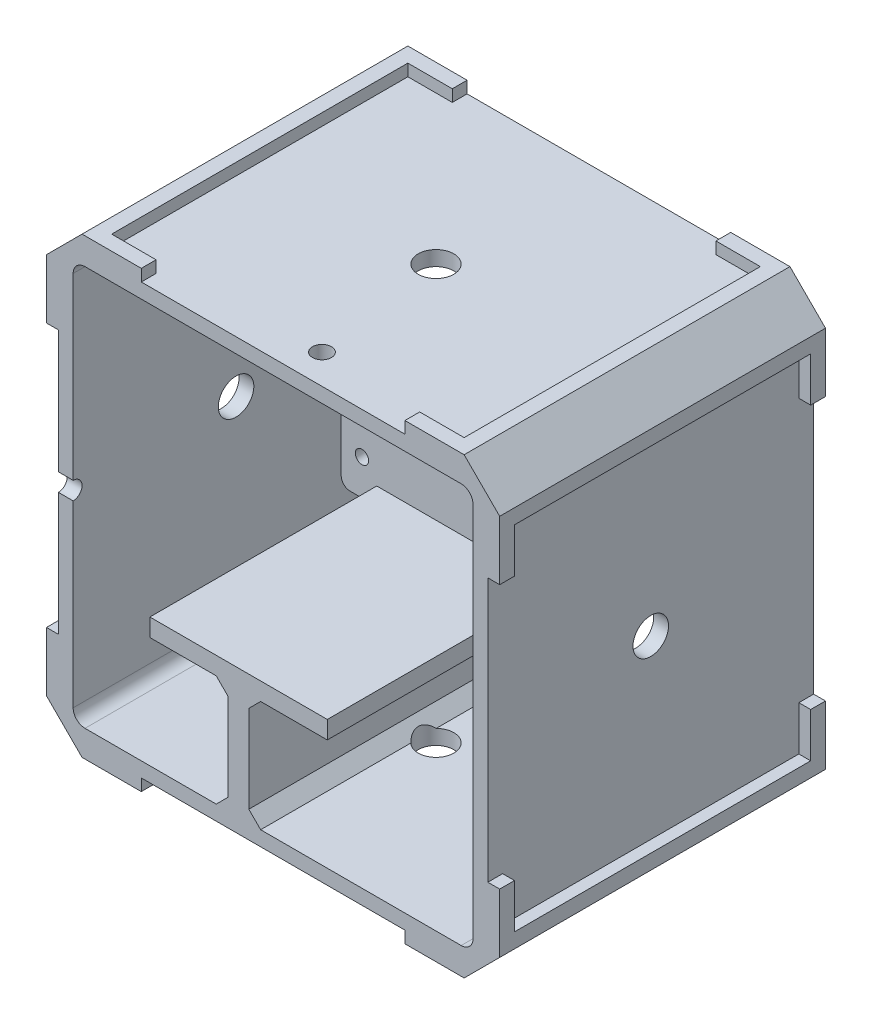
from build123d import *

# Parameters (mm, degrees)
BOSS_EXTRUDE1_DEPTH             = 55
SKETCH2_W                       = 67.5
SKETCH2_H                       = 67.5
BOSS_EXTRUDE2_DEPTH             = 2.5
CUT_EXTRUDE2_REACH              = 77.187
SKETCH4_R                       = 1.65
MIRROR2_COPY_1_REACH            = 77.187
MIRROR2_COPY_1_SKETCH_R         = 1.65
BOSS_EXTRUDE3_DEPTH             = 14.6
BOSS_EXTRUDE3_DEPTH_BACK        = 25.8
BOSS_EXTRUDE4_DEPTH             = 49.7
SKETCH7_W                       = 37.9
SKETCH7_H                       = 22.75
CUT_EXTRUDE3_DEPTH              = 8.4
BOSS_EXTRUDE7_DEPTH             = 2
CUT_EXTRUDE6_REACH              = 84.442
CUT_EXTRUDE6_DIRECTION_2_DEPTH  = 83.442009922
CUT_EXTRUDE8_DEPTH              = 103.907106169
CUT_EXTRUDE8_DEPTH_BACK         = 2.5
SKETCH15_R                      = 1.6
SKETCH16_W                      = 7.5
SKETCH16_H                      = 1.65
BOSS_EXTRUDE8_DEPTH             = 7
CUT_EXTRUDE9_REACH              = 74.438
SKETCH17_R                      = 1.125
SKETCH19_R                      = 3
CUT_EXTRUDE10_DEPTH             = 2.5
BOSS_EXTRUDE9_DEPTH             = 2
CIRPATTERN1_COUNT               = 4
CIRPATTERN2_COUNT               = 4
BOSS_EXTRUDE12_DEPTH            = 55
CUT_EXTRUDE12_REACH             = 75.459
SKETCH23_W                      = 6.5
SKETCH23_H                      = 16
CHAMFER1_SIZE                   = 0.75
CUT_EXTRUDE13_REACH             = 91.486
SKETCH25_W                      = 3
SKETCH25_H                      = 35
SKETCH25_W_2                    = 5
SKETCH25_H_2                    = 46.7
FILLET3_R                       = 1.5
SKETCH26_W                      = 12.543976605
SKETCH26_H                      = 9.586128164
CUT_EXTRUDE14_DEPTH             = 90.261665904
SKETCH27_W                      = 6.75
SKETCH27_H                      = 1.4
BOSS_EXTRUDE14_DEPTH            = 1.25
CHAMFER2_SIZE                   = 2
CUT_EXTRUDE15_REACH             = 85.744
SKETCH28_W                      = 7.624106446
SKETCH28_H                      = 46.373052842
SKETCH29_W                      = 40.4
SKETCH29_H                      = 3
BOSS_EXTRUDE15_DEPTH            = 18.75
BOSS_EXTRUDE16_DEPTH            = 4
CHAMFER3_SIZE                   = 0.75
CHAMFER3_OF_MIRROR3_SIZE        = 0.75
MIRROR4_START                   = 2.5
MIRROR4_DEPTH                   = 4
CUT_EXTRUDE16_REACH             = 102.191
SKETCH32_R                      = 1.5
CUT_EXTRUDE16_DIRECTION_2_DEPTH = 101.19137937
BOSS_EXTRUDE17_DEPTH            = 5
CUT_EXTRUDE17_REACH             = 68.28
SKETCH37_W                      = 5
SKETCH37_H                      = 18.75
SKETCH37_W_2                    = 5.675
BOSS_EXTRUDE18_DEPTH            = 5
BOSS_EXTRUDE19_DEPTH            = 3
FILLET4_R                       = 1.5
FILLET5_R                       = 1.5


with BuildPart() as part:
    # Sketch1 → Boss-Extrude1 (new body)
    with BuildSketch(Plane.XY):
        with BuildLine():
            Line((-36.25, 32.25), (-36.25, -32.25))
            ThreePointArc((-36.25, -32.25), (-35.078427125, -35.078427125), (-32.25, -36.25))
            Line((-32.25, -36.25), (32.25, -36.25))
            ThreePointArc((32.25, -36.25), (35.078427125, -35.078427125), (36.25, -32.25))
            Line((36.25, -32.25), (36.25, 32.25))
            ThreePointArc((36.25, 32.25), (35.078427125, 35.078427125), (32.25, 36.25))
            Line((32.25, 36.25), (-32.25, 36.25))
            ThreePointArc((-32.25, 36.25), (-35.078427125, 35.078427125), (-36.25, 32.25))
        make_face()
        with BuildLine():
            Line((-31.75, 33.75), (31.75, 33.75))
            ThreePointArc((31.75, 33.75), (33.164213562, 33.164213562), (33.75, 31.75))
            Line((33.75, 31.75), (33.75, -31.75))
            ThreePointArc((33.75, -31.75), (33.164213562, -33.164213562), (31.75, -33.75))
            Line((31.75, -33.75), (-31.75, -33.75))
            ThreePointArc((-31.75, -33.75), (-33.164213562, -33.164213562), (-33.75, -31.75))
            Line((-33.75, -31.75), (-33.75, 31.75))
            ThreePointArc((-33.75, 31.75), (-33.164213562, 33.164213562), (-31.75, 33.75))
        make_face(mode=Mode.SUBTRACT)
    extrude(amount=BOSS_EXTRUDE1_DEPTH)

    # Sketch2 → Boss-Extrude2 (add)
    with BuildSketch(Plane.XY):
        Rectangle(SKETCH2_W, SKETCH2_H)
    extrude(amount=BOSS_EXTRUDE2_DEPTH)

    # Sketch4 → Cut-Extrude2 (cut, up to next)
    with BuildSketch(Plane(origin=(0, 0, 0), x_dir=(-1, 0, 0), z_dir=(0, 0, -1)), mode=Mode.PRIVATE) as cut_extrude2_sk1:
        with Locations((-28.75, 28.75)):
            Circle(SKETCH4_R)
    cut_extrude2_tool1 = extrude(cut_extrude2_sk1.sketch, amount=-CUT_EXTRUDE2_REACH, mode=Mode.PRIVATE) & part.part
    cut_extrude2 = cut_extrude2_tool1.solids().sort_by_distance((28.75, 28.75, 0))[0]
    add(cut_extrude2, mode=Mode.SUBTRACT)

    # Mirror1: Cut-Extrude2 across plane
    add(cut_extrude2.mirror(Plane(origin=(0, 0, 0), x_dir=(0, 0, 1), z_dir=(1, 0, 0))), mode=Mode.SUBTRACT)

    # Mirror2: Cut-Extrude2 across plane
    add(cut_extrude2.mirror(Plane.ZX), mode=Mode.SUBTRACT)

    # Mirror2 copy 1 sketch → Mirror2 copy 1 (cut, up to next)
    with BuildSketch(Plane(origin=(0, 0, 0), x_dir=(1, 0, 0), z_dir=(0, 0, -1)), mode=Mode.PRIVATE) as mirror2_copy_1_sk1:
        with Locations((-28.75, 28.75)):
            Circle(MIRROR2_COPY_1_SKETCH_R)
    mirror2_copy_1_tool1 = extrude(mirror2_copy_1_sk1.sketch, amount=-MIRROR2_COPY_1_REACH, mode=Mode.PRIVATE) & part.part
    add(mirror2_copy_1_tool1.solids().sort_by_distance((-28.75, -28.75, 0))[0], mode=Mode.SUBTRACT)



with BuildPart() as body_2:
    # Sketch5 → Boss-Extrude3 (new, two sides: drawn at the far end of the back side and taken through both)
    with BuildSketch(Plane(origin=(0, 0, 0), x_dir=(0, 0, -1), z_dir=(1, 0, 0)).offset(-BOSS_EXTRUDE3_DEPTH_BACK)):
        Polygon((-16.7, 12), (-16.7, -12), (-60.4, -12), (-63.4, -12), (-63.4, -15), (-13.7, -15), (-13.7, 12), align=None)
    extrude(amount=BOSS_EXTRUDE3_DEPTH + BOSS_EXTRUDE3_DEPTH_BACK)


with BuildPart() as part_1:
    add(part.part)

    add(body_2.part)  # Boss-Extrude4 merges body 2
    # Sketch6 → Boss-Extrude4 (add)
    with BuildSketch(Plane.XY.offset(63.4)):
        Polygon((-25.8, -12), (12.1, -12), (12.1, -15), (-4.1, -15), (-4.1, -33.75), (12.1, -33.75), (12.1, -36.25), (-25.8, -36.25), (-25.8, -33.75), (-7.6, -33.75), (-7.6, -15), (-25.8, -15), align=None)
    extrude(amount=-BOSS_EXTRUDE4_DEPTH)

    # Sketch7 → Cut-Extrude3 (cut)
    with BuildSketch(Plane.XY.offset(63.4)):
        with Locations((-6.85, -24.875)):
            Rectangle(SKETCH7_W, SKETCH7_H)
    extrude(amount=-CUT_EXTRUDE3_DEPTH, mode=Mode.SUBTRACT)

    # Sketch12 → Boss-Extrude7 (add)
    with BuildSketch(Plane(origin=(0, 36.25, 0), x_dir=(1, 0, 0), z_dir=(0, 1, 0))):
        Polygon((29.75, -55), (32.25, -55), (32.25, -52.5), (32.25, -45), (29.75, -45), (29.75, -52.5), (22.25, -52.5), (22.25, -55), align=None)
        Polygon((-32.25, 0), (-32.25, -10), (-29.75, -10), (-29.75, -2.5), (-22.25, -2.5), (-22.25, 0), align=None)
    boss_extrude7 = extrude(amount=BOSS_EXTRUDE7_DEPTH)

    # Sketch13 → Cut-Extrude6 (cut, up to next)
    with BuildSketch(Plane(origin=(0, 0, 0), x_dir=(-1, 0, 0), z_dir=(0, 0, -1)), mode=Mode.PRIVATE) as cut_extrude6_sk1:
        with BuildLine():
            Line((-33.75, 21.25), (-25.25, 21.25))
            ThreePointArc((-25.25, 21.25), (-22.421572875, 22.421572875), (-21.25, 25.25))
            Line((-21.25, 25.25), (-21.25, 33.75))
            Line((-21.25, 33.75), (21.25, 33.75))
            Line((21.25, 33.75), (21.25, 25.25))
            ThreePointArc((21.25, 25.25), (22.421572875, 22.421572875), (25.25, 21.25))
            Line((25.25, 21.25), (33.75, 21.25))
            Line((33.75, 21.25), (33.75, -21.25))
            Line((33.75, -21.25), (25.25, -21.25))
            ThreePointArc((25.25, -21.25), (22.421572875, -22.421572875), (21.25, -25.25))
            Line((21.25, -25.25), (21.25, -33.75))
            Line((21.25, -33.75), (-21.25, -33.75))
            Line((-21.25, -33.75), (-21.25, -25.25))
            ThreePointArc((-21.25, -25.25), (-22.421572875, -22.421572875), (-25.25, -21.25))
            Line((-25.25, -21.25), (-33.75, -21.25))
            Line((-33.75, -21.25), (-33.75, 21.25))
        make_face()
    cut_extrude6_tool1 = extrude(cut_extrude6_sk1.sketch, amount=-CUT_EXTRUDE6_REACH, mode=Mode.PRIVATE) & part_1.part
    add(cut_extrude6_tool1.solids().sort_by_distance((0, 0, 0))[0], mode=Mode.SUBTRACT)

    # Sketch13 → Cut-Extrude6 direction 2 (cut)
    with BuildSketch(Plane(origin=(0, 0, 0), x_dir=(-1, 0, 0), z_dir=(0, 0, -1))):
        with BuildLine():
            Line((-33.75, 21.25), (-25.25, 21.25))
            ThreePointArc((-25.25, 21.25), (-22.421572875, 22.421572875), (-21.25, 25.25))
            Line((-21.25, 25.25), (-21.25, 33.75))
            Line((-21.25, 33.75), (21.25, 33.75))
            Line((21.25, 33.75), (21.25, 25.25))
            ThreePointArc((21.25, 25.25), (22.421572875, 22.421572875), (25.25, 21.25))
            Line((25.25, 21.25), (33.75, 21.25))
            Line((33.75, 21.25), (33.75, -21.25))
            Line((33.75, -21.25), (25.25, -21.25))
            ThreePointArc((25.25, -21.25), (22.421572875, -22.421572875), (21.25, -25.25))
            Line((21.25, -25.25), (21.25, -33.75))
            Line((21.25, -33.75), (-21.25, -33.75))
            Line((-21.25, -33.75), (-21.25, -25.25))
            ThreePointArc((-21.25, -25.25), (-22.421572875, -22.421572875), (-25.25, -21.25))
            Line((-25.25, -21.25), (-33.75, -21.25))
            Line((-33.75, -21.25), (-33.75, 21.25))
        make_face()
    extrude(amount=CUT_EXTRUDE6_DIRECTION_2_DEPTH, mode=Mode.SUBTRACT)

    # Sketch15 → Cut-Extrude8 (cut, two sides: drawn at the far end of the back side and taken through both)
    with BuildSketch(Plane(origin=(0, 36.25, 0), x_dir=(1, 0, 0), z_dir=(0, 1, 0)).offset(-CUT_EXTRUDE8_DEPTH_BACK)):
        with Locations(Location((3.25, -50, 0), (0, 0, 270))):
            Circle(SKETCH15_R)
    extrude(amount=CUT_EXTRUDE8_DEPTH + CUT_EXTRUDE8_DEPTH_BACK, mode=Mode.SUBTRACT)

    # Sketch16 → Boss-Extrude8 (add)
    with BuildSketch(Plane(origin=(-33.75, 0, 0), x_dir=(0, 0, -1), z_dir=(1, 0, 0))):
        with Locations((-16.5, 29.525)):
            Rectangle(SKETCH16_W, SKETCH16_H)
    extrude(amount=BOSS_EXTRUDE8_DEPTH)

    # Sketch17 → Cut-Extrude9 (cut, up to next)
    with BuildSketch(Plane(origin=(0, 0, 13.7), x_dir=(-1, 0, 0), z_dir=(0, 0, -1)), mode=Mode.PRIVATE) as cut_extrude9_sk1:
        with Locations(Location((-12.1, 9, 0), (0, 0, 90))):
            Circle(SKETCH17_R)
    cut_extrude9_tool1 = extrude(cut_extrude9_sk1.sketch, amount=-CUT_EXTRUDE9_REACH, mode=Mode.PRIVATE) & part_1.part
    # Sketch17 → Cut-Extrude9 (cut, up to next)
    with BuildSketch(Plane(origin=(0, 0, 13.7), x_dir=(-1, 0, 0), z_dir=(0, 0, -1)), mode=Mode.PRIVATE) as cut_extrude9_sk2:
        with Locations(Location((-12.1, -9, 0), (0, 0, 90))):
            Circle(SKETCH17_R)
    cut_extrude9_tool2 = extrude(cut_extrude9_sk2.sketch, amount=-CUT_EXTRUDE9_REACH, mode=Mode.PRIVATE) & part_1.part
    # Sketch17 → Cut-Extrude9 (cut, up to next)
    with BuildSketch(Plane(origin=(0, 0, 13.7), x_dir=(-1, 0, 0), z_dir=(0, 0, -1)), mode=Mode.PRIVATE) as cut_extrude9_sk3:
        with Locations(Location((23.3, -9, 0), (0, 0, 90))):
            Circle(SKETCH17_R)
    cut_extrude9_tool3 = extrude(cut_extrude9_sk3.sketch, amount=-CUT_EXTRUDE9_REACH, mode=Mode.PRIVATE) & part_1.part
    add(cut_extrude9_tool1.solids().sort_by_distance((12.1, 9, 13.7))[0], mode=Mode.SUBTRACT)
    add(cut_extrude9_tool2.solids().sort_by_distance((12.1, -9, 13.7))[0], mode=Mode.SUBTRACT)
    add(cut_extrude9_tool3.solids().sort_by_distance((-23.3, -9, 13.7))[0], mode=Mode.SUBTRACT)

    # Sketch19 → Cut-Extrude10 (cut)
    with BuildSketch(Plane(origin=(0, 36.25, 0), x_dir=(1, 0, 0), z_dir=(0, 1, 0))):
        with Locations(Location((0, -27.5, 0), (0, 0, 270))):
            Circle(SKETCH19_R)
    cut_extrude10 = extrude(amount=-CUT_EXTRUDE10_DEPTH, mode=Mode.SUBTRACT)

    # Sketch20 → Boss-Extrude9 (add)
    with BuildSketch(Plane(origin=(36.25, 0, -36.25), x_dir=(0, 0, 1), z_dir=(-1, 0, 0))):
        Polygon((91.25, 32.25), (81.25, 32.25), (81.25, 29.75), (88.75, 29.75), (88.75, 22.25), (91.25, 22.25), align=None)
        Polygon((36.25, -22.25), (36.25, -32.25), (46.25, -32.25), (46.25, -29.75), (38.75, -29.75), (38.75, -22.25), align=None)
    boss_extrude9 = extrude(amount=-BOSS_EXTRUDE9_DEPTH)

    # CirPattern1: Boss-Extrude7, Cut-Extrude10 ×4 about axis
    cirpattern1_axis = Axis((0, 0, 0), (0, 0, 1))
    add([boss_extrude7.rotate(cirpattern1_axis, i * 360 / CIRPATTERN1_COUNT) for i in range(1, CIRPATTERN1_COUNT)])
    add([cut_extrude10.rotate(cirpattern1_axis, i * 360 / CIRPATTERN1_COUNT) for i in range(1, CIRPATTERN1_COUNT)], mode=Mode.SUBTRACT)

    # CirPattern2: Boss-Extrude9 ×4 about axis
    cirpattern2_axis = Axis((0, 0, 0), (0, 0, 1))
    for i in range(1, CIRPATTERN2_COUNT):
        add(boss_extrude9.rotate(cirpattern2_axis, i * 360 / CIRPATTERN2_COUNT))

    # Sketch22 → Boss-Extrude12 (add, through all)
    with BuildSketch(Plane.XY.offset(55)):
        Polygon((-38.25, 32.25), (-32.25, 38.25), (-29.75, 38.25), (-29.75, 33.75), (-33.75, 33.75), (-33.75, 29.75), (-38.25, 29.75), align=None)
        Polygon((33.75, 33.75), (33.75, 29.75), (38.25, 29.75), (38.25, 32.25), (32.25, 38.25), (29.75, 38.25), (29.75, 33.75), align=None)
        Polygon((38.25, -32.25), (32.25, -38.25), (29.75, -38.25), (29.75, -33.75), (33.75, -33.75), (33.75, -29.75), (38.25, -29.75), align=None)
        Polygon((-33.75, -33.75), (-33.75, -29.75), (-38.25, -29.75), (-38.25, -32.25), (-32.25, -38.25), (-29.75, -38.25), (-29.75, -33.75), align=None)
    extrude(amount=-BOSS_EXTRUDE12_DEPTH)

    # Sketch23 → Cut-Extrude12 (cut, up to next)
    with BuildSketch(Plane(origin=(0, 0, 13.7), x_dir=(-1, 0, 0), z_dir=(0, 0, -1)), mode=Mode.PRIVATE) as cut_extrude12_sk1:
        with Locations((22.55, 4)):
            Rectangle(SKETCH23_W, SKETCH23_H)
    cut_extrude12_tool1 = extrude(cut_extrude12_sk1.sketch, amount=-CUT_EXTRUDE12_REACH, mode=Mode.PRIVATE) & part_1.part
    add(cut_extrude12_tool1.solids().sort_by_distance((-22.55, 4, 13.7))[0], mode=Mode.SUBTRACT)

    # Chamfer1
    chamfer1_edges = [part_1.edges().sort_by_distance(p)[0] for p in [
        (-33.75, 28.7, 16.5),
        (-30.25, 30.35, 20.25),
        (-26.75, 30.35, 16.5),
    ]]
    chamfer(chamfer1_edges, length=CHAMFER1_SIZE)

    # Sketch25 → Cut-Extrude13 (cut, up to next)
    with BuildSketch(Plane(origin=(0, -12, 0), x_dir=(1, 0, 0), z_dir=(0, 1, 0)), mode=Mode.PRIVATE) as cut_extrude13_sk1:
        with Locations((13.1, -45.9)):
            Rectangle(SKETCH25_W, SKETCH25_H)
    cut_extrude13_tool1 = extrude(cut_extrude13_sk1.sketch, amount=-CUT_EXTRUDE13_REACH, mode=Mode.PRIVATE) & part_1.part
    # Sketch25 → Cut-Extrude13 (cut, up to next)
    with BuildSketch(Plane(origin=(0, -12, 0), x_dir=(1, 0, 0), z_dir=(0, 1, 0)), mode=Mode.PRIVATE) as cut_extrude13_sk2:
        with Locations((-23.3, -40.05)):
            Rectangle(SKETCH25_W_2, SKETCH25_H_2)
    cut_extrude13_tool2 = extrude(cut_extrude13_sk2.sketch, amount=-CUT_EXTRUDE13_REACH, mode=Mode.PRIVATE) & part_1.part
    add(cut_extrude13_tool1.solids().sort_by_distance((13.1, -12, 45.9))[0], mode=Mode.SUBTRACT)
    add(cut_extrude13_tool2.solids().sort_by_distance((-23.3, -12, 40.05))[0], mode=Mode.SUBTRACT)

    # Fillet3
    fillet3_edges = [part_1.edges().sort_by_distance(p)[0] for p in [
        (-19.3, -4, 15.2),
        (-19.3, 12, 15.2),
        (-25.8, -4, 15.2),
    ]]
    fillet(fillet3_edges, radius=FILLET3_R)

    # Sketch26 → Cut-Extrude14 (cut, through all)
    with BuildSketch(Plane(origin=(11.6, 0, 0), x_dir=(0, 0, -1), z_dir=(1, 0, 0))):
        with Locations((-61.271988302, -13.249120227)):
            Rectangle(SKETCH26_W, SKETCH26_H)
    extrude(amount=-CUT_EXTRUDE14_DEPTH, mode=Mode.SUBTRACT)

    # Sketch27 → Boss-Extrude14 (add)
    with BuildSketch(Plane(origin=(-33.75, 0, 0), x_dir=(0, 0, -1), z_dir=(1, 0, 0))):
        with Locations((-16.125, 31.05)):
            Rectangle(SKETCH27_W, SKETCH27_H)
    extrude(amount=BOSS_EXTRUDE14_DEPTH)

    # Chamfer2
    # the kernel refuses this chamfer: 2 mm, written as the material it adds along each edge
    with BuildSketch(Plane(origin=(-4.1, -33.75, 13.7), x_dir=(1, 0, 0), z_dir=(0, 0, 1))) as chamfer2_piece_1_section:
        Polygon((CHAMFER2_SIZE, 0), (0, CHAMFER2_SIZE), (0, 0), align=None)
    chamfer2_piece_1 = extrude(amount=41.3, mode=Mode.PRIVATE)
    chamfer2_piece_1 = chamfer2_piece_1 - Plane(origin=(0, -33.75, 27.5), x_dir=(0, 0, 1), z_dir=(0, -1, 0)) * Cylinder(3, 91, mode=Mode.PRIVATE)
    add(chamfer2_piece_1)
    with BuildSketch(Plane(origin=(-4.1, -15, 55), x_dir=(0, -1, 0), z_dir=(0, 0, -1)), Plane(origin=(-7.6, -33.75, 55), x_dir=(0, 1, 0), z_dir=(0, 0, -1))) as chamfer2_piece_2:
        Polygon((CHAMFER2_SIZE, 0), (0, -CHAMFER2_SIZE), (0, 0), align=None)
    extrude(amount=41.3)
    with BuildSketch(Plane(origin=(-7.6, -15, 55), x_dir=(0, -1, 0), z_dir=(0, 0, -1))) as chamfer2_piece_3:
        Polygon((CHAMFER2_SIZE, 0), (0, CHAMFER2_SIZE), (0, 0), align=None)
    extrude(amount=41.3)

    # Sketch28 → Cut-Extrude15 (cut, up to next)
    with BuildSketch(Plane(origin=(0, -12, 0), x_dir=(1, 0, 0), z_dir=(0, 1, 0)), mode=Mode.PRIVATE) as cut_extrude15_sk1:
        with Locations((12.962053223, -39.886526421)):
            Rectangle(SKETCH28_W, SKETCH28_H)
    cut_extrude15_tool1 = extrude(cut_extrude15_sk1.sketch, amount=-CUT_EXTRUDE15_REACH, mode=Mode.PRIVATE) & part_1.part
    add(cut_extrude15_tool1.solids().sort_by_distance((12.962053, -12, 39.886526))[0], mode=Mode.SUBTRACT)

    # Sketch29 → Boss-Extrude15 (add)
    with BuildSketch(Plane(origin=(0, -15, 0), x_dir=(-1, 0, 0), z_dir=(0, -1, 0))):
        with Locations((5.6, -15.2)):
            Rectangle(SKETCH29_W, SKETCH29_H)
    extrude(amount=BOSS_EXTRUDE15_DEPTH)

    # Sketch31 → Boss-Extrude16 (add)
    with BuildSketch(Plane.XY.offset(2.5)):
        with BuildLine():
            Line((-33.75, 21.25), (-33.75, 33.75))
            Line((-33.75, 33.75), (-21.25, 33.75))
            Line((-21.25, 33.75), (-21.25, 25.25))
            ThreePointArc((-21.25, 25.25), (-22.421572875, 22.421572875), (-25.25, 21.25))
            Line((-25.25, 21.25), (-33.75, 21.25))
        make_face()
        Polygon((-28.75, 32.069764048), (-31.625, 30.409882024), (-31.625, 27.090117976), (-28.75, 25.430235952), (-25.875, 27.090117976), (-25.875, 30.409882024), align=None, mode=Mode.SUBTRACT)
    boss_extrude16 = extrude(amount=BOSS_EXTRUDE16_DEPTH)

    # Chamfer3
    chamfer3_edges = [part_1.edges().sort_by_distance(p)[0] for p in [
        (-27.3125, 31.239823036, 6.5),
        (-30.1875, 31.239823036, 6.5),
        (-31.625, 28.75, 6.5),
        (-30.1875, 26.260176964, 6.5),
        (-27.3125, 26.260176964, 6.5),
        (-25.875, 28.75, 6.5),
    ]]
    chamfer(chamfer3_edges, length=CHAMFER3_SIZE)

    # Mirror3: Boss-Extrude16 across plane
    add(boss_extrude16.mirror(Plane(origin=(0, 0, 0), x_dir=(0, 0, 1), z_dir=(1, 0, 0))))

    # Chamfer3 of Mirror3
    chamfer3_of_mirror3_edges = [part_1.edges().sort_by_distance(p)[0] for p in [
        (27.3125, 31.239823036, 6.5),
        (30.1875, 31.239823036, 6.5),
        (31.625, 28.75, 6.5),
        (30.1875, 26.260176964, 6.5),
        (27.3125, 26.260176964, 6.5),
        (25.875, 28.75, 6.5),
    ]]
    chamfer(chamfer3_of_mirror3_edges, length=CHAMFER3_OF_MIRROR3_SIZE)

    # Mirror4: read off the stored shape, not the designer's step
    # Mirror4 outline → Mirror4 (add)
    # profile 1 of 2: a face of its own
    with BuildSketch(Plane.XY.offset(MIRROR4_START)):
        with BuildLine():
            Line((33.75, -31.75), (33.75, -21.25))
            Line((33.75, -21.25), (25.25, -21.25))
            ThreePointArc((25.25, -21.25), (22.421572875, -22.421572875), (21.25, -25.25))
            Line((21.25, -25.25), (21.25, -33.75))
            Line((21.25, -33.75), (31.75, -33.75))
            ThreePointArc((31.75, -33.75), (33.164213562, -33.164213562), (33.75, -31.75))
        make_face()
        Polygon((28.75, -32.069764048), (25.875, -30.409882024), (25.875, -27.090117976), (28.75, -25.430235952), (31.625, -27.090117976), (31.625, -30.409882024), align=None, mode=Mode.SUBTRACT)
    # profile 2 of 2: a face of its own
    with BuildSketch(Plane.XY.offset(MIRROR4_START)):
        with BuildLine():
            Line((-31.75, -33.75), (-21.25, -33.75))
            Line((-21.25, -33.75), (-21.25, -25.25))
            ThreePointArc((-21.25, -25.25), (-22.421572875, -22.421572875), (-25.25, -21.25))
            Line((-25.25, -21.25), (-33.75, -21.25))
            Line((-33.75, -21.25), (-33.75, -31.75))
            ThreePointArc((-33.75, -31.75), (-33.164213562, -33.164213562), (-31.75, -33.75))
        make_face()
        Polygon((-31.625, -30.409882024), (-31.625, -27.090117976), (-28.75, -25.430235952), (-25.875, -27.090117976), (-25.875, -30.409882024), (-28.75, -32.069764048), align=None, mode=Mode.SUBTRACT)
    extrude(amount=MIRROR4_DEPTH)

    # Mirror4 2: loft between two sections, ruled curve by curve
    mirror4_2_from = [
        Edge.make_line((-25.875, -27.090117976, 5.75), (-25.875, -30.409882024, 5.75)),
        Edge.make_line((-31.625, -30.409882024, 5.75), (-31.625, -27.090117976, 5.75)),
        Edge.make_line((-25.875, -30.409882024, 5.75), (-28.75, -32.069764048, 5.75)),
        Edge.make_line((-25.875, -27.090117976, 5.75), (-28.75, -25.430235952, 5.75)),
        Edge.make_line((-28.75, -32.069764048, 5.75), (-31.625, -30.409882024, 5.75)),
        Edge.make_line((-28.75, -25.430235952, 5.75), (-31.625, -27.090117976, 5.75)),
    ]
    mirror4_2_to = [
        Edge.make_line((-25.125, -26.657105274, 6.5), (-25.125, -30.842894726, 6.5)),
        Edge.make_line((-32.375, -30.842894726, 6.5), (-32.375, -26.657105274, 6.5)),
        Edge.make_line((-25.125, -30.842894726, 6.5), (-28.75, -32.935789452, 6.5)),
        Edge.make_line((-25.125, -26.657105274, 6.5), (-28.75, -24.564210548, 6.5)),
        Edge.make_line((-28.75, -32.935789452, 6.5), (-32.375, -30.842894726, 6.5)),
        Edge.make_line((-28.75, -24.564210548, 6.5), (-32.375, -26.657105274, 6.5)),
    ]
    mirror4_2 = Solid(Shell([*[Face.make_surface_from_curves(mirror4_2_from[k], mirror4_2_to[k]) for k in range(6)], Face(Wire(mirror4_2_from)), Face(Wire(mirror4_2_to))]))
    add(mirror4_2, mode=Mode.SUBTRACT)

    # Mirror4 3: loft between two sections, ruled curve by curve
    mirror4_3_from = [
        Edge.make_line((25.875, -27.090117976, 5.75), (25.875, -30.409882024, 5.75)),
        Edge.make_line((31.625, -30.409882024, 5.75), (31.625, -27.090117976, 5.75)),
        Edge.make_line((25.875, -30.409882024, 5.75), (28.75, -32.069764048, 5.75)),
        Edge.make_line((25.875, -27.090117976, 5.75), (28.75, -25.430235952, 5.75)),
        Edge.make_line((28.75, -32.069764048, 5.75), (31.625, -30.409882024, 5.75)),
        Edge.make_line((28.75, -25.430235952, 5.75), (31.625, -27.090117976, 5.75)),
    ]
    mirror4_3_to = [
        Edge.make_line((25.125, -26.657105274, 6.5), (25.125, -30.842894726, 6.5)),
        Edge.make_line((32.375, -30.842894726, 6.5), (32.375, -26.657105274, 6.5)),
        Edge.make_line((25.125, -30.842894726, 6.5), (28.75, -32.935789452, 6.5)),
        Edge.make_line((25.125, -26.657105274, 6.5), (28.75, -24.564210548, 6.5)),
        Edge.make_line((28.75, -32.935789452, 6.5), (32.375, -30.842894726, 6.5)),
        Edge.make_line((28.75, -24.564210548, 6.5), (32.375, -26.657105274, 6.5)),
    ]
    mirror4_3 = Solid(Shell([*[Face.make_surface_from_curves(mirror4_3_from[k], mirror4_3_to[k]) for k in range(6)], Face(Wire(mirror4_3_from)), Face(Wire(mirror4_3_to))]))
    add(mirror4_3, mode=Mode.SUBTRACT)

    # Sketch32 → Cut-Extrude16 (cut, up to next)
    with BuildSketch(Plane.ZY.offset(36.25), mode=Mode.PRIVATE) as cut_extrude16_sk1:
        with Locations((55, 0)):
            Circle(SKETCH32_R)
    cut_extrude16_tool1 = extrude(cut_extrude16_sk1.sketch, amount=-CUT_EXTRUDE16_REACH, mode=Mode.PRIVATE) & part_1.part
    add(cut_extrude16_tool1.solids().sort_by_distance((-36.25, 0, 55))[0], mode=Mode.SUBTRACT)

    # Sketch32 → Cut-Extrude16 direction 2 (cut)
    with BuildSketch(Plane.ZY.offset(36.25)):
        with Locations((55, 0)):
            Circle(SKETCH32_R)
    extrude(amount=CUT_EXTRUDE16_DIRECTION_2_DEPTH, mode=Mode.SUBTRACT)

    # Sketch34 → Boss-Extrude17 (add)
    with BuildSketch(Plane(origin=(0, 1, 0), x_dir=(1, 0, 0), z_dir=(0, 1, 0))):
        Polygon((33.75, 0), (28.75, 0), (28.75, -5), (30.75, -5), (30.75, -2), (33.75, -2), align=None)
    extrude(amount=BOSS_EXTRUDE17_DEPTH)

    # Sketch37 → Cut-Extrude17 (cut, up to next)
    with BuildSketch(Plane.XY.offset(16.7), mode=Mode.PRIVATE) as cut_extrude17_sk1:
        with Locations((-23.3, -24.375)):
            Rectangle(SKETCH37_W, SKETCH37_H)
    cut_extrude17_tool1 = extrude(cut_extrude17_sk1.sketch, amount=-CUT_EXTRUDE17_REACH, mode=Mode.PRIVATE) & part_1.part
    # Sketch37 → Cut-Extrude17 (cut, up to next)
    with BuildSketch(Plane.XY.offset(16.7), mode=Mode.PRIVATE) as cut_extrude17_sk2:
        with Locations((11.9875, -24.375)):
            Rectangle(SKETCH37_W_2, SKETCH37_H)
    cut_extrude17_tool2 = extrude(cut_extrude17_sk2.sketch, amount=-CUT_EXTRUDE17_REACH, mode=Mode.PRIVATE) & part_1.part
    add(cut_extrude17_tool1.solids().sort_by_distance((-23.3, -24.375, 16.7))[0], mode=Mode.SUBTRACT)
    add(cut_extrude17_tool2.solids().sort_by_distance((11.9875, -24.375, 16.7))[0], mode=Mode.SUBTRACT)

    # Sketch35 → Boss-Extrude18 (add)
    with BuildSketch(Plane(origin=(0, -1, 0), x_dir=(1, 0, 0), z_dir=(0, 1, 0))):
        Polygon((30.75, 0), (30.75, -3), (33.75, -3), (33.75, -5), (28.75, -5), (28.75, 0), align=None)
    extrude(amount=-BOSS_EXTRUDE18_DEPTH)

    # Sketch36 → Boss-Extrude19 (add)
    with BuildSketch(Plane(origin=(0, 0, 13.7), x_dir=(-1, 0, 0), z_dir=(0, 0, -1))):
        Polygon((-15.6, 12.5), (-15.6, -15), (-14.6, -15), (-14.052921839, 10.290373182), (-8.498490792, 11.115288684), (18.340009821, -8.537374602), (24.897997882, -6.724757663), (25.8, -15), (26.8, -15), (26.8, -4), (19.3, 12.5), align=None)
    extrude(amount=-BOSS_EXTRUDE19_DEPTH)

    # Fillet4
    fillet4_edges = [part_1.edges().sort_by_distance(p)[0] for p in [
        (3.525, -33.75, 16.7),
        (-15.2, -33.75, 16.7),
        (-5.825, -33.75, 13.7),
        (-20.8, -33.75, 15.2),
        (9.15, -33.75, 15.2),
    ]]
    fillet(fillet4_edges, radius=FILLET4_R)

    # Fillet5
    # the kernel refuses this fillet: 1.5 mm, written as the material it adds along each edge
    with BuildSketch(Plane(origin=(-20.8, -15, 16.7), x_dir=(0, -1, 0), z_dir=(0, 0, -1))) as fillet5_piece_1:
        with BuildLine():
            CenterArc((FILLET5_R, FILLET5_R), FILLET5_R, 180, 90)
            Line((0, FILLET5_R), (0, 0))
            Line((0, 0), (FILLET5_R, 0))
        make_face()
    extrude(amount=3)
    with BuildSketch(Plane(origin=(9.15, -15, 16.7), x_dir=(0, -1, 0), z_dir=(0, 0, -1))) as fillet5_piece_2:
        with BuildLine():
            CenterArc((FILLET5_R, -FILLET5_R), FILLET5_R, 90, 90)
            Line((0, -FILLET5_R), (0, 0))
            Line((0, 0), (FILLET5_R, 0))
        make_face()
    extrude(amount=3)
    # the kernel refuses this fillet: 1.5 mm, written as the material it takes off along each edge
    with BuildSketch(Plane(origin=(-26.8, -15, 9.95), x_dir=(0, 1, 0), z_dir=(0, 0, 1)), Plane(origin=(15.6, 12.5, 9.95), x_dir=(0, -1, 0), z_dir=(0, 0, 1)), Plane(origin=(15.6, -15, 9.95), x_dir=(-1, 0, 0), z_dir=(0, 0, 1))) as fillet5_2_piece_1:
        with BuildLine():
            CenterArc((FILLET5_R, -FILLET5_R), FILLET5_R, 90, 90)
            Line((0, -FILLET5_R), (0, 0))
            Line((0, 0), (FILLET5_R, 0))
        make_face()
    extrude(amount=10.5, mode=Mode.SUBTRACT)
    with BuildSketch(Plane(origin=(-26.8, -4, 12.88771552), x_dir=(0.4138029443011817, 0.9103664774626058, 0), z_dir=(0, 0, 1))) as fillet5_2_piece_2:
        with BuildLine():
            CenterArc((FILLET5_R * 0.216609194719, -FILLET5_R), FILLET5_R, 90, 24.44395478)
            Line((-FILLET5_R * 0.197193749582, -FILLET5_R * 0.0896335225374), (0, 0))
            Line((0, 0), (FILLET5_R * 0.216609194719, 0))
        make_face()
    extrude(amount=4.62456896, mode=Mode.SUBTRACT)
    with BuildSketch(Plane(origin=(-19.3, 12.5, 11.285325236), x_dir=(1, 0, 0), z_dir=(0, 0, 1))) as fillet5_2_piece_3:
        with BuildLine():
            CenterArc((FILLET5_R * 0.643913270327, -FILLET5_R), FILLET5_R, 90, 65.55604522)
            Line((-FILLET5_R * 0.266453207136, -FILLET5_R * 0.586197055699), (0, 0))
            Line((0, 0), (FILLET5_R * 0.643913270327, 0))
        make_face()
    extrude(amount=7.829349527, mode=Mode.SUBTRACT)


solid = part_1.part
